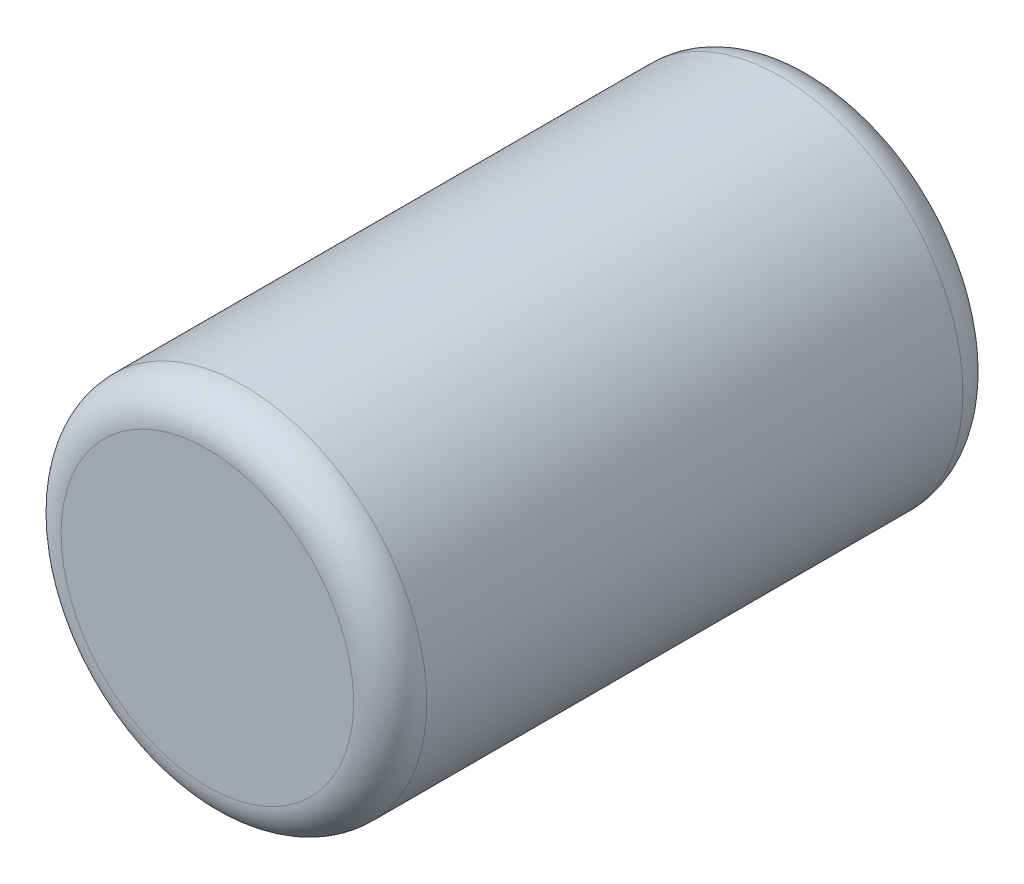
from build123d import *


with BuildPart() as part:
    # Эскиз2 → Повернуть1 (revolve)
    with BuildSketch(Plane(origin=(0, 0, 0), x_dir=(0, 0, -1), z_dir=(1, 0, 0))):
        with BuildLine():
            Line((0, 0), (-5, 0))
            Line((-5, 0), (-5, -1.2))
            ThreePointArc((-5, -1.2), (-4.912132034, -1.412132034), (-4.7, -1.5))
            Line((-4.7, -1.5), (-0.3, -1.5))
            ThreePointArc((-0.3, -1.5), (-0.087867966, -1.412132034), (0, -1.2))
            Line((0, -1.2), (0, 0))
        make_face()
    revolve(axis=Axis((0, 0, 0), (0, 0, 1)))


solid = part.part
